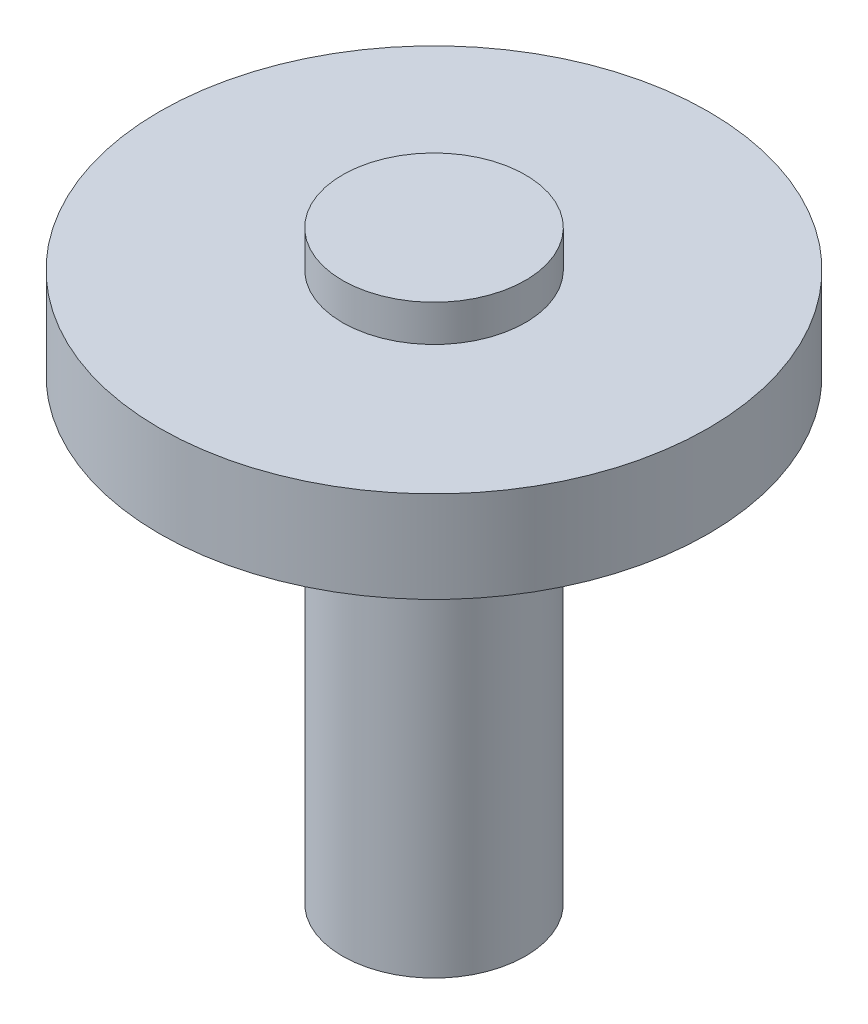
from build123d import *

# Parameters (mm, degrees)
SKETCH1_R           = 15
BOSS_EXTRUDE1_DEPTH = 5
SKETCH3_R           = 5
BOSS_EXTRUDE2_DEPTH = 2
BOSS_EXTRUDE3_START = 25
SKETCH2_R           = 5
BOSS_EXTRUDE3_DEPTH = 25


with BuildPart() as part:
    # Sketch1 → Boss-Extrude1 (new body)
    with BuildSketch(Plane(origin=(0, 0, 0), x_dir=(1, 0, 0), z_dir=(0, 1, 0))):
        Circle(SKETCH1_R)
    extrude(amount=BOSS_EXTRUDE1_DEPTH)

    # Sketch3 → Boss-Extrude2 (add)
    with BuildSketch(Plane(origin=(0, 5, 0), x_dir=(1, 0, 0), z_dir=(0, 1, 0))):
        Circle(SKETCH3_R)
    extrude(amount=BOSS_EXTRUDE2_DEPTH)

    # Sketch2 → Boss-Extrude3 (add)
    with BuildSketch(Plane.XZ.offset(BOSS_EXTRUDE3_START)):
        Circle(SKETCH2_R)
    extrude(amount=-BOSS_EXTRUDE3_DEPTH)


solid = part.part
